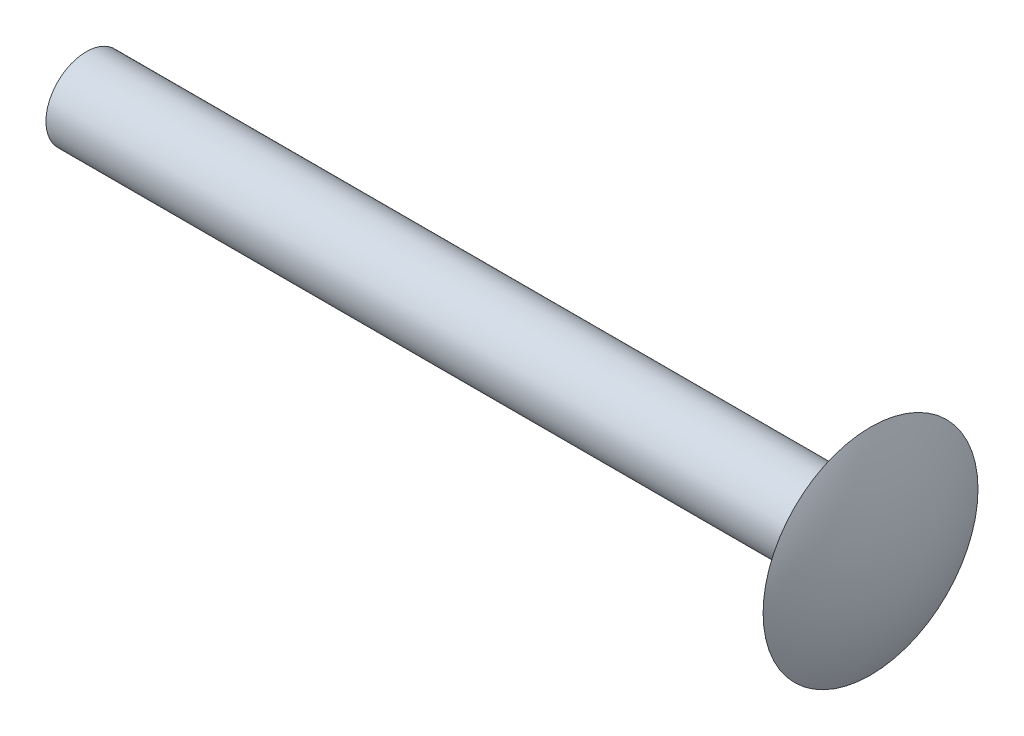
from build123d import *

# Parameters (mm, degrees)
SHAFT_SKETCH_R      = 7.5
SHAFT_EXTRUDE_DEPTH = 146


with BuildPart() as part:
    # Shaft Sketch → Shaft Extrude (new body)
    with BuildSketch(Plane(origin=(0, 0, 0), x_dir=(0, 0, -1), z_dir=(1, 0, 0))):
        Circle(SHAFT_SKETCH_R)
    extrude(amount=SHAFT_EXTRUDE_DEPTH)

    # Head Sketch → Head Revolution (revolve)
    with BuildSketch(Plane.XY):
        with BuildLine():
            Line((151, 0), (146, 0))
            Line((146, 0), (146, 20))
            ThreePointArc((146, 20), (149.731056256, 10.307764064), (151, 0))
        make_face()
    revolve(axis=Axis((151, 0, 0), (-1, 0, 0)))


solid = part.part
